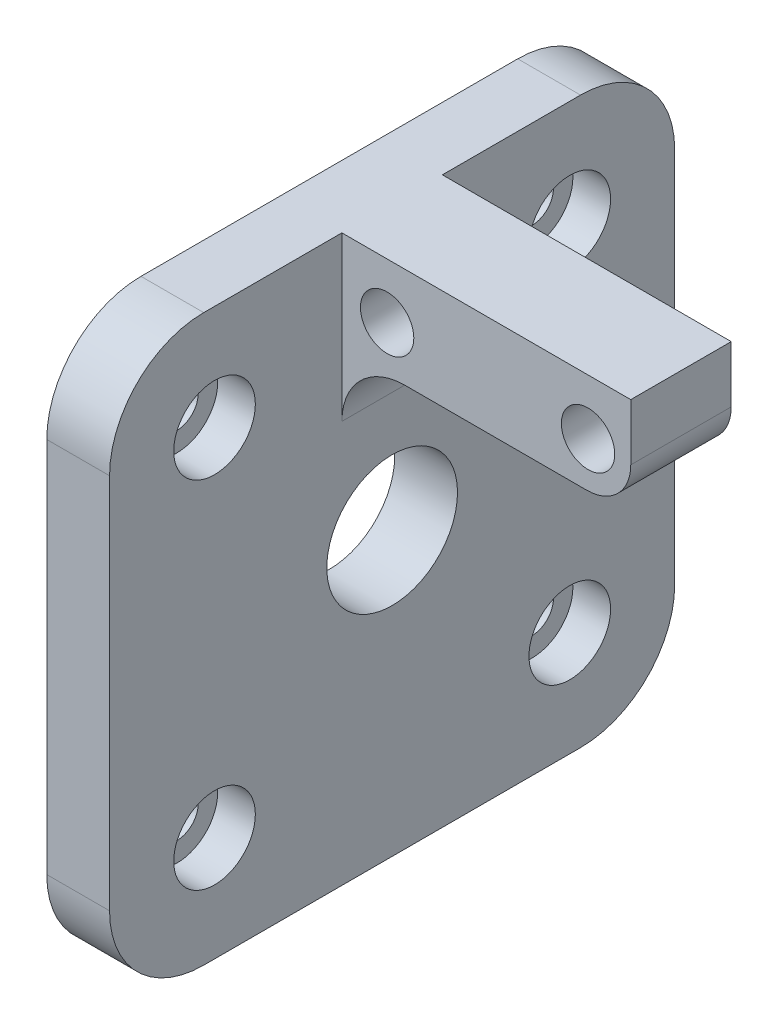
from build123d import *

# Parameters (mm, degrees)
SKETCH1_W                      = 45
SKETCH1_H                      = 45
SKETCH1_R                      = 5.205
BOSS_EXTRUDE1_DEPTH            = 5
SKETCH1_3_W                    = 8
SKETCH1_3_H                    = 8
BOSS_EXTRUDE2_DEPTH            = 28
FILLET1_R                      = 7.5
FILLET2_R                      = 5
FILLET3_R                      = 3.5
CUT_EXTRUDE1_DEPTH             = 43.385138905
CUT_EXTRUDE1_DEPTH_BACK        = 43.385138905
SKETCH2_R                      = 2.125
CBORE_FOR_M3_SHCS1_D           = 3.4
CBORE_FOR_M3_SHCS1_CBORE_D     = 6.5
CBORE_FOR_M3_SHCS1_CBORE_DEPTH = 3


with BuildPart() as part:
    # Sketch1 → Boss-Extrude1 (new body)
    with BuildSketch(Plane(origin=(0, 0, 0), x_dir=(0, 0, -1), z_dir=(1, 0, 0))):
        Rectangle(SKETCH1_W, SKETCH1_H)
        Circle(SKETCH1_R, mode=Mode.SUBTRACT)
    extrude(amount=BOSS_EXTRUDE1_DEPTH)

    # Sketch1<3> → Boss-Extrude2 (add)
    with BuildSketch(Plane(origin=(0, 0, 0), x_dir=(0, 0, -1), z_dir=(1, 0, 0))):
        with Locations((0, 18.5)):
            Rectangle(SKETCH1_3_W, SKETCH1_3_H)
    extrude(amount=BOSS_EXTRUDE2_DEPTH)

    # Fillet1
    fillet1_edges = [part.edges().sort_by_distance(p)[0] for p in [
        (2.5, -22.5, 22.5),
        (2.5, -22.5, -22.5),
        (2.5, 22.5, -22.5),
        (2.5, 22.5, 22.5),
    ]]
    fillet(fillet1_edges, radius=FILLET1_R)

    # Fillet2
    fillet2_edges = [part.edges().sort_by_distance(p)[0] for p in [
        (5, 14.5, 0),
    ]]
    fillet(fillet2_edges, radius=FILLET2_R)

    # Fillet3
    fillet3_edges = [part.edges().sort_by_distance(p)[0] for p in [
        (28, 14.5, 0),
    ]]
    fillet(fillet3_edges, radius=FILLET3_R)

    # Sketch2 → Cut-Extrude1 (cut, two sides: drawn at the far end of the back side and taken through both)
    with BuildSketch(Plane.XY.offset(-CUT_EXTRUDE1_DEPTH_BACK)):
        with Locations((8.6, 18.1)):
            Circle(SKETCH2_R)
        with Locations((24.6, 18.1)):
            Circle(SKETCH2_R)
    extrude(amount=CUT_EXTRUDE1_DEPTH + CUT_EXTRUDE1_DEPTH_BACK, mode=Mode.SUBTRACT)

    # CBORE for M3 SHCS1 (through all)
    with Locations(Plane(origin=(5, 0, 0), x_dir=(0, 0, -1), z_dir=(1, 0, 0))):
        with Locations((-14.142135624, 14.142135624), (14.142135624, 14.142135624), (-14.142135624, -14.142135624), (14.142135624, -14.142135624)):
            CounterBoreHole(CBORE_FOR_M3_SHCS1_D / 2, CBORE_FOR_M3_SHCS1_CBORE_D / 2, CBORE_FOR_M3_SHCS1_CBORE_DEPTH)


solid = part.part
